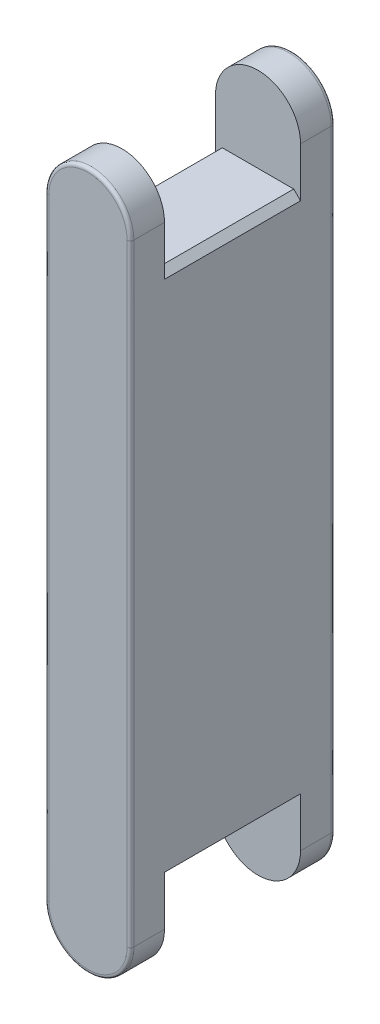
from build123d import *

# Parameters (mm, degrees)
EXTRUDE_1_DEPTH     = 30
SKETCH_2_W          = 46.70760299
SKETCH_2_H          = 25
SKETCH_2_W_2        = 54.68279318
CUT_EXTRUDE_1_DEPTH = 20
CHAMFER_1_SIZE      = 2
FILLET_1_SIZE       = 1


with BuildPart() as part:
    # 草图1 → 凸台-拉伸1 (new, symmetric)
    with BuildSketch(Plane.XY):
        with BuildLine():
            Line((-12.5, 0), (-12.5, 180))
            ThreePointArc((-12.5, 180), (0, 192.5), (12.5, 180))
            Line((12.5, 180), (12.5, 0))
            ThreePointArc((12.5, 0), (0, -12.5), (-12.5, 0))
        make_face()
    extrude(amount=EXTRUDE_1_DEPTH, both=True)

    # 草图2 → 切除-拉伸1 (cut, symmetric)
    with BuildSketch(Plane.XY):
        Rectangle(SKETCH_2_W, SKETCH_2_H)
        with Locations((0, 180)):
            Rectangle(SKETCH_2_W_2, SKETCH_2_H)
    extrude(amount=CUT_EXTRUDE_1_DEPTH, both=True, mode=Mode.SUBTRACT)

    # 倒角1
    chamfer_1_edges = [part.edges().sort_by_distance(p)[0] for p in [
        (-12.5, 167.5, 0),
        (-12.5, 12.5, 0),
        (12.5, 12.5, 0),
        (12.5, 167.5, 0),
    ]]
    chamfer(chamfer_1_edges, length=CHAMFER_1_SIZE)

    # 圆角1
    # a fillet whose section is not a circle: 1 mm, written as the material it takes off along each edge
    with BuildSketch(Plane(origin=(-12.5, 0, 30), x_dir=(0, 0, -1), z_dir=(0, 1, 0)), Plane(origin=(12.5, 180, 30), x_dir=(0, 0, -1), z_dir=(0, -1, 0))) as fillet_1_piece_1:
        with BuildLine():
            add(Edge.make_bspline([(FILLET_1_SIZE, 0), (FILLET_1_SIZE * 0.831801948466, 0), (FILLET_1_SIZE * 0.663603896932, 0), (FILLET_1_SIZE * 0.292893218813, -FILLET_1_SIZE * 0.0716919198361), (FILLET_1_SIZE * 0.0716919198361, -FILLET_1_SIZE * 0.292893218813), (0, -FILLET_1_SIZE * 0.663603896932), (0, -FILLET_1_SIZE * 0.831801948466), (0, -FILLET_1_SIZE)], knots=[0, 0, 0, 0, 0, 0, 0.5, 0.5, 1, 1, 1, 1, 1, 1], degree=5))
            Line((0, -FILLET_1_SIZE), (-FILLET_1_SIZE * 0.02, -FILLET_1_SIZE))
            Line((-FILLET_1_SIZE * 0.02, -FILLET_1_SIZE), (-FILLET_1_SIZE * 0.02, FILLET_1_SIZE * 0.02))
            Line((-FILLET_1_SIZE * 0.02, FILLET_1_SIZE * 0.02), (FILLET_1_SIZE, FILLET_1_SIZE * 0.02))
            Line((FILLET_1_SIZE, FILLET_1_SIZE * 0.02), (FILLET_1_SIZE, 0))
        make_face()
    extrude(amount=180, mode=Mode.SUBTRACT)
    with BuildSketch(Plane(origin=(0, 180, 30), x_dir=(-1, 0, 0), z_dir=(0, -1, 0))) as fillet_1_piece_2:
        with BuildLine():
            add(Edge.make_bspline([(12.5 - FILLET_1_SIZE, 0), (12.5 - FILLET_1_SIZE * 0.831801948466, 0), (12.5 - FILLET_1_SIZE * 0.663603896932, 0), (12.5 - FILLET_1_SIZE * 0.292893218813, FILLET_1_SIZE * 0.0716919198361), (12.5 - FILLET_1_SIZE * 0.0716919198361, FILLET_1_SIZE * 0.292893218813), (12.5, FILLET_1_SIZE * 0.663603896932), (12.5, FILLET_1_SIZE * 0.831801948466), (12.5, FILLET_1_SIZE)], knots=[0, 0, 0, 0, 0, 0, 0.5, 0.5, 1, 1, 1, 1, 1, 1], degree=5))
            Line((12.5, FILLET_1_SIZE), (12.5 + FILLET_1_SIZE * 0.02, FILLET_1_SIZE))
            Line((12.5 + FILLET_1_SIZE * 0.02, FILLET_1_SIZE), (12.5 + FILLET_1_SIZE * 0.02, -FILLET_1_SIZE * 0.02))
            Line((12.5 + FILLET_1_SIZE * 0.02, -FILLET_1_SIZE * 0.02), (12.5 - FILLET_1_SIZE, -FILLET_1_SIZE * 0.02))
            Line((12.5 - FILLET_1_SIZE, -FILLET_1_SIZE * 0.02), (12.5 - FILLET_1_SIZE, 0))
        make_face()
    revolve(axis=Axis((0, 180, 30), (0, 0, -1)), revolution_arc=180, mode=Mode.SUBTRACT)
    with BuildSketch(Plane(origin=(0, 0, 30), x_dir=(1, 0, 0), z_dir=(0, 1, 0))) as fillet_1_piece_3:
        with BuildLine():
            add(Edge.make_bspline([(12.5, FILLET_1_SIZE), (12.5, FILLET_1_SIZE * 0.831801948466), (12.5, FILLET_1_SIZE * 0.663603896932), (12.5 - FILLET_1_SIZE * 0.0716919198361, FILLET_1_SIZE * 0.292893218813), (12.5 - FILLET_1_SIZE * 0.292893218813, FILLET_1_SIZE * 0.0716919198361), (12.5 - FILLET_1_SIZE * 0.663603896932, 0), (12.5 - FILLET_1_SIZE * 0.831801948466, 0), (12.5 - FILLET_1_SIZE, 0)], knots=[0, 0, 0, 0, 0, 0, 0.5, 0.5, 1, 1, 1, 1, 1, 1], degree=5))
            Line((12.5 - FILLET_1_SIZE, 0), (12.5 - FILLET_1_SIZE, -FILLET_1_SIZE * 0.02))
            Line((12.5 - FILLET_1_SIZE, -FILLET_1_SIZE * 0.02), (12.5 + FILLET_1_SIZE * 0.02, -FILLET_1_SIZE * 0.02))
            Line((12.5 + FILLET_1_SIZE * 0.02, -FILLET_1_SIZE * 0.02), (12.5 + FILLET_1_SIZE * 0.02, FILLET_1_SIZE))
            Line((12.5 + FILLET_1_SIZE * 0.02, FILLET_1_SIZE), (12.5, FILLET_1_SIZE))
        make_face()
    revolve(axis=Axis((0, 0, 30), (0, 0, -1)), revolution_arc=180, mode=Mode.SUBTRACT)
    with BuildSketch(Plane(origin=(12.5, 180, -30), x_dir=(0, 0, 1), z_dir=(0, -1, 0)), Plane(origin=(-12.5, 0, -30), x_dir=(0, 0, 1), z_dir=(0, 1, 0))) as fillet_1_piece_4:
        with BuildLine():
            add(Edge.make_bspline([(FILLET_1_SIZE, 0), (FILLET_1_SIZE * 0.831801948466, 0), (FILLET_1_SIZE * 0.663603896932, 0), (FILLET_1_SIZE * 0.292893218813, FILLET_1_SIZE * 0.0716919198361), (FILLET_1_SIZE * 0.0716919198361, FILLET_1_SIZE * 0.292893218813), (0, FILLET_1_SIZE * 0.663603896932), (0, FILLET_1_SIZE * 0.831801948466), (0, FILLET_1_SIZE)], knots=[0, 0, 0, 0, 0, 0, 0.5, 0.5, 1, 1, 1, 1, 1, 1], degree=5))
            Line((0, FILLET_1_SIZE), (-FILLET_1_SIZE * 0.02, FILLET_1_SIZE))
            Line((-FILLET_1_SIZE * 0.02, FILLET_1_SIZE), (-FILLET_1_SIZE * 0.02, -FILLET_1_SIZE * 0.02))
            Line((-FILLET_1_SIZE * 0.02, -FILLET_1_SIZE * 0.02), (FILLET_1_SIZE, -FILLET_1_SIZE * 0.02))
            Line((FILLET_1_SIZE, -FILLET_1_SIZE * 0.02), (FILLET_1_SIZE, 0))
        make_face()
    extrude(amount=180, mode=Mode.SUBTRACT)
    with BuildSketch(Plane(origin=(0, 180, -30), x_dir=(-1, 0, 0), z_dir=(0, -1, 0))) as fillet_1_piece_5:
        with BuildLine():
            add(Edge.make_bspline([(12.5, -FILLET_1_SIZE), (12.5, -FILLET_1_SIZE * 0.831801948466), (12.5, -FILLET_1_SIZE * 0.663603896932), (12.5 - FILLET_1_SIZE * 0.0716919198361, -FILLET_1_SIZE * 0.292893218813), (12.5 - FILLET_1_SIZE * 0.292893218813, -FILLET_1_SIZE * 0.0716919198361), (12.5 - FILLET_1_SIZE * 0.663603896932, 0), (12.5 - FILLET_1_SIZE * 0.831801948466, 0), (12.5 - FILLET_1_SIZE, 0)], knots=[0, 0, 0, 0, 0, 0, 0.5, 0.5, 1, 1, 1, 1, 1, 1], degree=5))
            Line((12.5 - FILLET_1_SIZE, 0), (12.5 - FILLET_1_SIZE, FILLET_1_SIZE * 0.02))
            Line((12.5 - FILLET_1_SIZE, FILLET_1_SIZE * 0.02), (12.5 + FILLET_1_SIZE * 0.02, FILLET_1_SIZE * 0.02))
            Line((12.5 + FILLET_1_SIZE * 0.02, FILLET_1_SIZE * 0.02), (12.5 + FILLET_1_SIZE * 0.02, -FILLET_1_SIZE))
            Line((12.5 + FILLET_1_SIZE * 0.02, -FILLET_1_SIZE), (12.5, -FILLET_1_SIZE))
        make_face()
    revolve(axis=Axis((0, 180, -30), (0, 0, -1)), revolution_arc=180, mode=Mode.SUBTRACT)
    with BuildSketch(Plane(origin=(0, 0, -30), x_dir=(1, 0, 0), z_dir=(0, 1, 0))) as fillet_1_piece_6:
        with BuildLine():
            add(Edge.make_bspline([(12.5 - FILLET_1_SIZE, 0), (12.5 - FILLET_1_SIZE * 0.831801948466, 0), (12.5 - FILLET_1_SIZE * 0.663603896932, 0), (12.5 - FILLET_1_SIZE * 0.292893218813, -FILLET_1_SIZE * 0.0716919198361), (12.5 - FILLET_1_SIZE * 0.0716919198361, -FILLET_1_SIZE * 0.292893218813), (12.5, -FILLET_1_SIZE * 0.663603896932), (12.5, -FILLET_1_SIZE * 0.831801948466), (12.5, -FILLET_1_SIZE)], knots=[0, 0, 0, 0, 0, 0, 0.5, 0.5, 1, 1, 1, 1, 1, 1], degree=5))
            Line((12.5, -FILLET_1_SIZE), (12.5 + FILLET_1_SIZE * 0.02, -FILLET_1_SIZE))
            Line((12.5 + FILLET_1_SIZE * 0.02, -FILLET_1_SIZE), (12.5 + FILLET_1_SIZE * 0.02, FILLET_1_SIZE * 0.02))
            Line((12.5 + FILLET_1_SIZE * 0.02, FILLET_1_SIZE * 0.02), (12.5 - FILLET_1_SIZE, FILLET_1_SIZE * 0.02))
            Line((12.5 - FILLET_1_SIZE, FILLET_1_SIZE * 0.02), (12.5 - FILLET_1_SIZE, 0))
        make_face()
    revolve(axis=Axis((0, 0, -30), (0, 0, -1)), revolution_arc=180, mode=Mode.SUBTRACT)


solid = part.part
